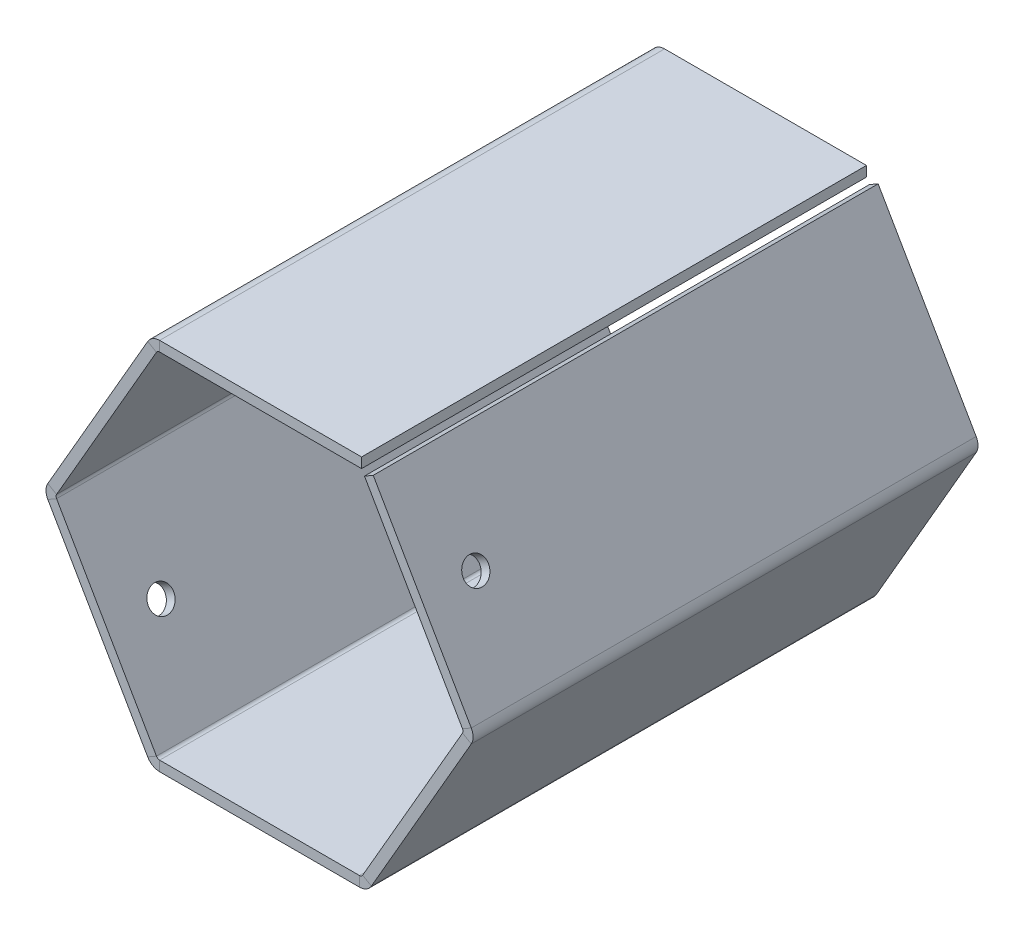
from build123d import *

# Parameters (mm, degrees)
LOFTED_BENDS1_DEPTH = 100
SKETCH11_R          = 2.5
CUT_EXTRUDE1_DEPTH  = 137.408236331


# Read off the part's stored shape, not the designer's step: Lofted Bends1
with BuildPart() as part:
    # Lofted Bends1 outline → Lofted Bends1 (new body)
    with BuildSketch(Plane.XY):
        with BuildLine():
            Line((20.207259422, 35), (20.207259422, 37))
            Line((20.207259422, 37), (-19.781983213, 37))
            ThreePointArc((-19.781983213, 37), (-21.150283213, 36.63336512), (-22.151948333, 35.6317))
            Line((-22.151948333, 35.6317), (-41.933931547, 1.3683))
            ThreePointArc((-41.933931547, 1.3683), (-42.300566427, 0), (-41.933931547, -1.3683))
            Line((-41.933931547, -1.3683), (-22.151948333, -35.6317))
            ThreePointArc((-22.151948333, -35.6317), (-21.150283213, -36.63336512), (-19.781983213, -37))
            Line((-19.781983213, -37), (19.781983213, -37))
            ThreePointArc((19.781983213, -37), (21.150283213, -36.63336512), (22.151948333, -35.6317))
            Line((22.151948333, -35.6317), (41.933931547, -1.3683))
            ThreePointArc((41.933931547, -1.3683), (42.300566427, 0), (41.933931547, 1.3683))
            Line((41.933931547, 1.3683), (22.514616839, 35.003539722))
            Line((22.514616839, 35.003539722), (20.782566032, 34.003539722))
            Line((20.782566032, 34.003539722), (40.201880739, 0.3683))
            ThreePointArc((40.201880739, 0.3683), (40.300566427, 0), (40.201880739, -0.3683))
            Line((40.201880739, -0.3683), (20.419897526, -34.6317))
            ThreePointArc((20.419897526, -34.6317), (20.150283213, -34.901314312), (19.781983213, -35))
            Line((19.781983213, -35), (-19.781983213, -35))
            ThreePointArc((-19.781983213, -35), (-20.150283213, -34.901314312), (-20.419897526, -34.6317))
            Line((-20.419897526, -34.6317), (-40.201880739, -0.3683))
            ThreePointArc((-40.201880739, -0.3683), (-40.300566427, 0), (-40.201880739, 0.3683))
            Line((-40.201880739, 0.3683), (-20.419897526, 34.6317))
            ThreePointArc((-20.419897526, 34.6317), (-20.150283213, 34.901314312), (-19.781983213, 35))
            Line((-19.781983213, 35), (20.207259422, 35))
        make_face()
    extrude(amount=LOFTED_BENDS1_DEPTH)

    # Sketch11 → Cut-Extrude1 (cut, through all)
    with BuildSketch(Plane(origin=(32.04293994, 18.5, 0), x_dir=(0, 0, -1), z_dir=(0.8660254037844385, 0.5000000000000004, 0))):
        with Locations(Location((-89.390171196, -0.362668506, 0), (0, 0, 270))):
            Circle(SKETCH11_R)
    extrude(amount=-CUT_EXTRUDE1_DEPTH, mode=Mode.SUBTRACT)


solid = part.part
